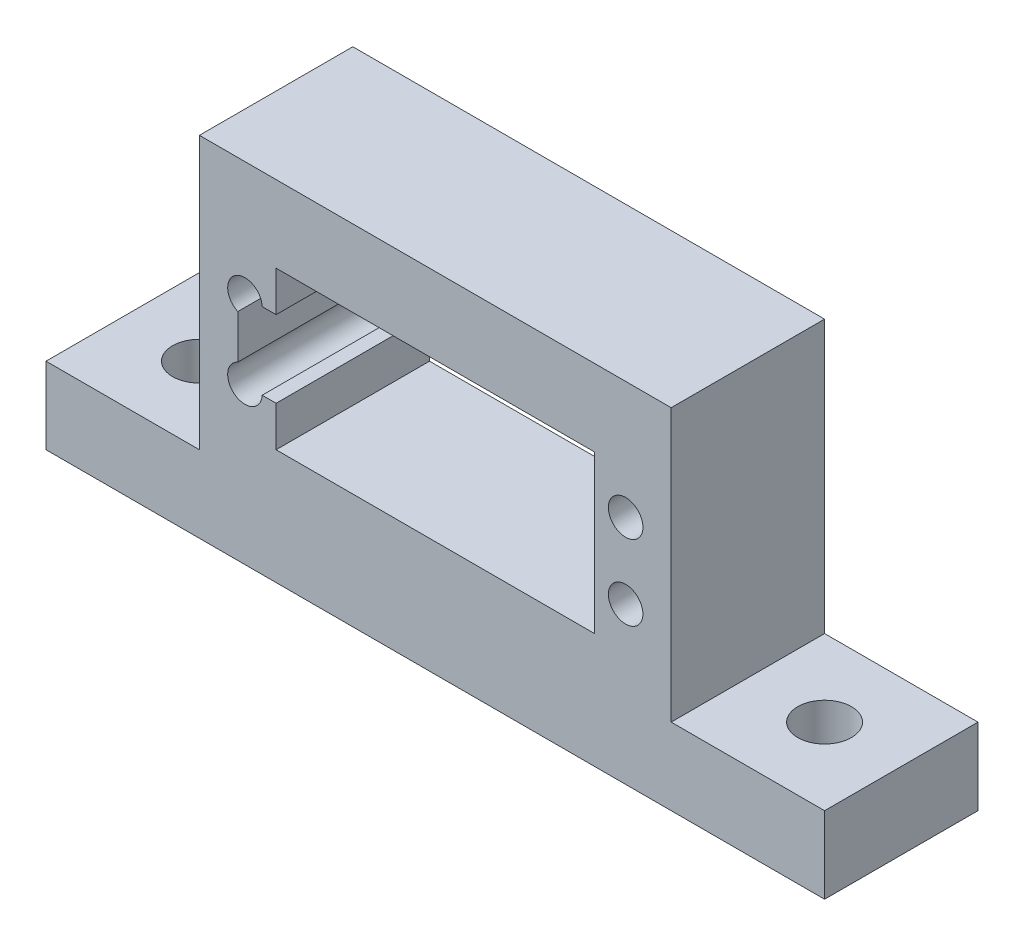
from build123d import *

# Parameters (mm, degrees)
SKETCH1_R           = 2.25
BOSS_EXTRUDE1_DEPTH = 20
SKETCH2_R           = 3.5
CUT_EXTRUDE1_DEPTH  = 66.083119931


with BuildPart() as part:
    # Sketch1 → Boss-Extrude1 (new body)
    with BuildSketch(Plane.XY):
        Polygon((-50.75, 0), (50.75, 0), (50.75, 10), (30.75, 10), (30.75, 45.5), (-30.75, 45.5), (-30.75, 10), (-50.75, 10), align=None)
        with Locations((24.815, 30.15)):
            Circle(SKETCH1_R, mode=Mode.SUBTRACT)
        with Locations((24.815, 20.35)):
            Circle(SKETCH1_R, mode=Mode.SUBTRACT)
        with BuildLine():
            Line((-20.75, 35.5), (20.75, 35.5))
            Line((20.75, 35.5), (20.75, 15))
            Line((20.75, 15), (-20.75, 15))
            Line((-20.75, 15), (-20.75, 20.25))
            Line((-20.75, 20.25), (-22.567223321, 20.25))
            ThreePointArc((-22.567223321, 20.25), (-26.07307026, 18.484588726), (-25.75, 22.396527547))
            Line((-25.75, 22.396527547), (-25.75, 28.103472453))
            ThreePointArc((-25.75, 28.103472453), (-26.07307026, 32.015411274), (-22.567223321, 30.25))
            Line((-22.567223321, 30.25), (-20.75, 30.25))
            Line((-20.75, 30.25), (-20.75, 35.5))
        make_face(mode=Mode.SUBTRACT)
    extrude(amount=BOSS_EXTRUDE1_DEPTH)

    # Sketch2 → Cut-Extrude1 (cut, through all)
    with BuildSketch(Plane(origin=(0, 10, 0), x_dir=(1, 0, 0), z_dir=(0, 1, 0))):
        with Locations((40.75, -10)):
            Circle(SKETCH2_R)
        with Locations((-40.75, -10)):
            Circle(SKETCH2_R)
    extrude(amount=-CUT_EXTRUDE1_DEPTH, mode=Mode.SUBTRACT)


solid = part.part
